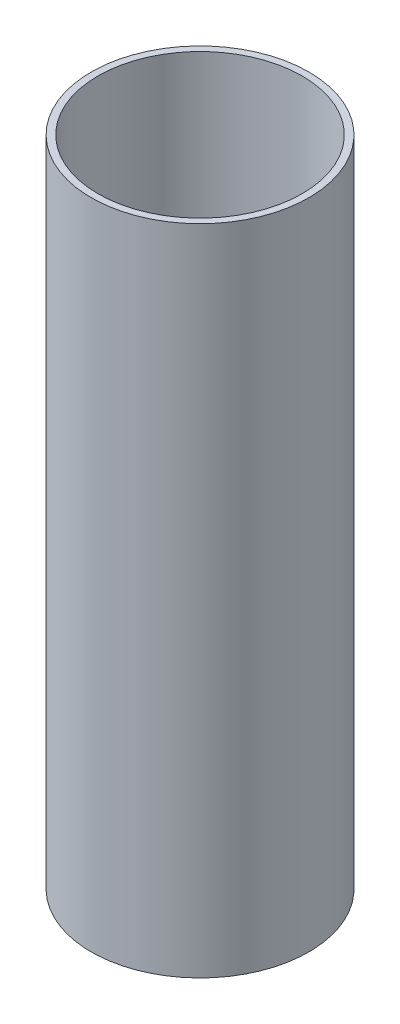
from build123d import *

# Parameters (mm, degrees)
SKETCH1_R           = 25.4
SKETCH1_R_2         = 23.8125
BOSS_EXTRUDE1_DEPTH = 152.4


with BuildPart() as part:
    # Sketch1 → Boss-Extrude1 (new body)
    with BuildSketch(Plane(origin=(0, 0, 0), x_dir=(1, 0, 0), z_dir=(0, 1, 0))):
        Circle(SKETCH1_R)
        Circle(SKETCH1_R_2, mode=Mode.SUBTRACT)
    extrude(amount=BOSS_EXTRUDE1_DEPTH)


solid = part.part
